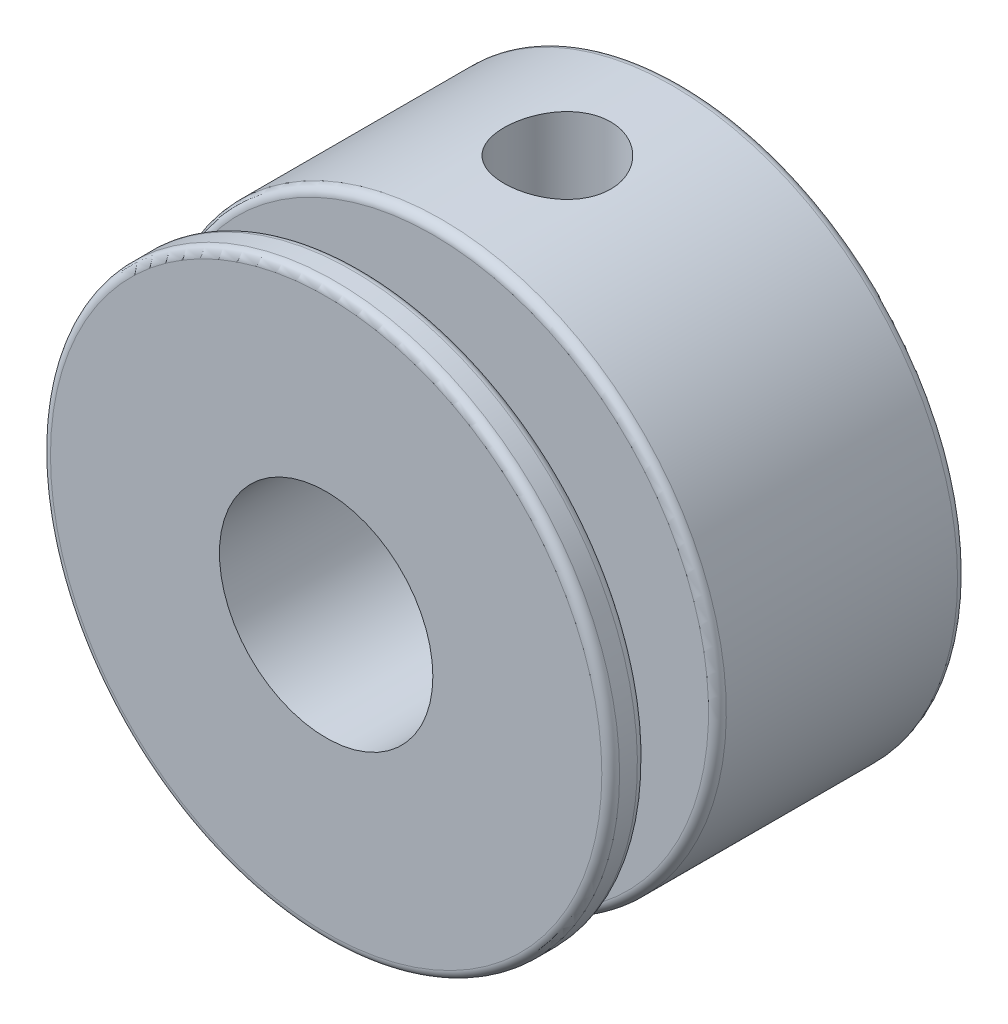
from build123d import *

# Parameters (mm, degrees)
SKETCH1_R           = 8
BOSS_EXTRUDE1_DEPTH = 10
SKETCH2_W           = 2
SKETCH2_H           = 3
CUT_EXTRUDE1_REACH  = 19.6
CUT_EXTRUDE1_START  = 2.5
SKETCH5_R           = 1.5
CUT_EXTRUDE2_REACH  = 17.1
SKETCH6_R           = 3
FILLET3_R           = 0.25
FILLET4_R           = 0.25
FILLET5_R           = 0.25


with BuildPart() as part:
    # Sketch1 → Boss-Extrude1 (new body)
    with BuildSketch(Plane.XY):
        Circle(SKETCH1_R)
    extrude(amount=BOSS_EXTRUDE1_DEPTH)

    # Sketch2 → Cut-Revolve2 (revolve, cut)
    with BuildSketch(Plane(origin=(0, 0, 0), x_dir=(0, 0, -1), z_dir=(1, 0, 0))):
        with Locations((-8, 6.5)):
            Rectangle(SKETCH2_W, SKETCH2_H)
    revolve(axis=Axis((0, 0, -5.249485175), (0, 0, 1)), mode=Mode.SUBTRACT)

    # Sketch5 → Cut-Extrude1 (cut, up to next)
    with BuildSketch(Plane(origin=(0, 0, 0), x_dir=(1, 0, 0), z_dir=(0, 1, 0)).offset(CUT_EXTRUDE1_START), mode=Mode.PRIVATE) as cut_extrude1_sk1:
        with Locations((0, -3.5)):
            Circle(SKETCH5_R)
    cut_extrude1_tool1 = extrude(cut_extrude1_sk1.sketch, amount=CUT_EXTRUDE1_REACH, mode=Mode.PRIVATE) & part.part
    add(cut_extrude1_tool1.solids().sort_by_distance((0, 2.5, 3.5))[0], mode=Mode.SUBTRACT)

    # Sketch6 → Cut-Extrude2 (cut, up to next)
    with BuildSketch(Plane.XY, mode=Mode.PRIVATE) as cut_extrude2_sk1:
        Circle(SKETCH6_R)
    cut_extrude2_tool1 = extrude(cut_extrude2_sk1.sketch, amount=CUT_EXTRUDE2_REACH, mode=Mode.PRIVATE) & part.part
    add(cut_extrude2_tool1.solids().sort_by_distance((0, 0, 0))[0], mode=Mode.SUBTRACT)

    # Fillet3
    fillet3_edges = [part.edges().sort_by_distance(p)[0] for p in [
        (-8, 0, 9),
    ]]
    fillet(fillet3_edges, radius=FILLET3_R)

    # Fillet4
    fillet4_edges = [part.edges().sort_by_distance(p)[0] for p in [
        (-8, 0, 7),
    ]]
    fillet(fillet4_edges, radius=FILLET4_R)

    # Fillet5
    fillet5_edges = [part.edges().sort_by_distance(p)[0] for p in [
        (-8, 0, 0),
        (-8, 0, 10),
    ]]
    fillet(fillet5_edges, radius=FILLET5_R)


solid = part.part
